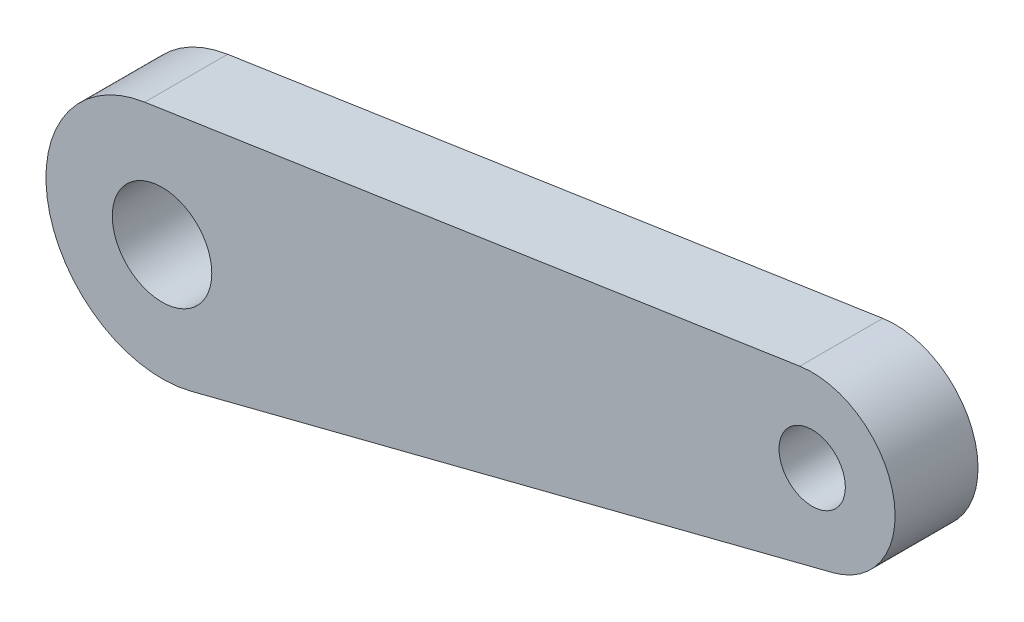
from build123d import *

# Parameters (mm, degrees)
BOSS_EXTRUDE1_START = 10
SKETCH1_R           = 3
SKETCH1_R_2         = 2
BOSS_EXTRUDE1_DEPTH = 5


with BuildPart() as part:
    # Sketch1 → Boss-Extrude1 (new body)
    with BuildSketch(Plane.XY.offset(BOSS_EXTRUDE1_START)):
        with BuildLine():
            Line((-61.044527949, 24.921629964), (-21.541827876, 30.882895517))
            ThreePointArc((-21.541827876, 30.882895517), (-15.895203545, 26.931233378), (-19.559591798, 21.094088637))
            Line((-19.559591798, 21.094088637), (-58.26939744, 11.217300333))
            ThreePointArc((-58.26939744, 11.217300333), (-66.860746115, 16.61069703), (-61.044527949, 24.921629964))
        make_face()
        with Locations((-60, 18)):
            Circle(SKETCH1_R, mode=Mode.SUBTRACT)
        with Locations((-20.795736484, 25.938874114)):
            Circle(SKETCH1_R_2, mode=Mode.SUBTRACT)
    extrude(amount=BOSS_EXTRUDE1_DEPTH)


solid = part.part
